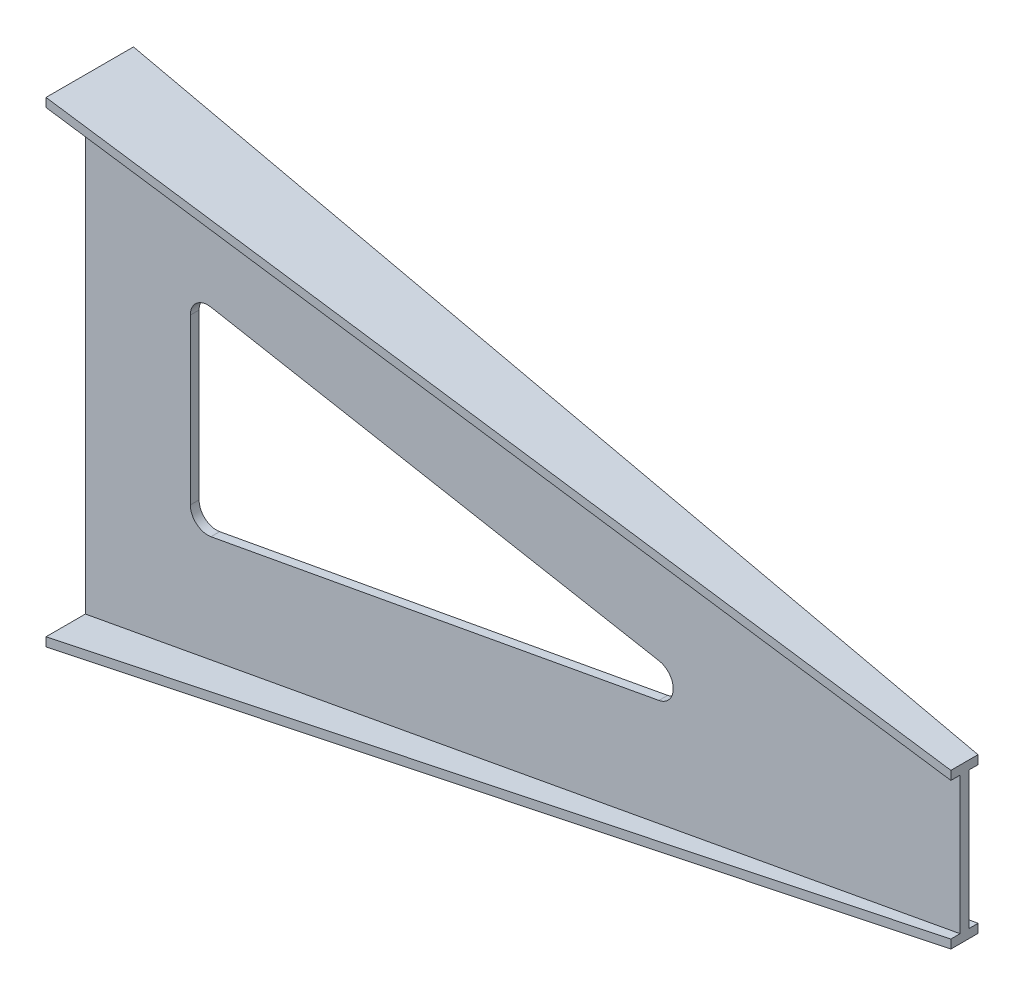
from build123d import *

# Parameters (mm, degrees)
CUT_EXTRUDE1_DEPTH = 1038.790441402


with BuildPart() as part:
    # Sketch1 → Loft l4 section 0
    with BuildSketch(Plane(origin=(0, 0, 0), x_dir=(0, 0, -1), z_dir=(1, 0, 0))):
        with BuildLine():
            Line((-55, 272), (45, 272))
            Line((45, 272), (45, 262))
            Line((45, 262), (0, 262))
            Line((0, 262), (0, -262))
            Line((0, -262), (45, -262))
            Line((45, -262), (45, -272))
            Line((45, -272), (-55, -272))
            Line((-55, -272), (-55, -262))
            Line((-55, -262), (-10, -262))
            Line((-10, -262), (-10, 262))
            Line((-10, 262), (-55, 262))
            Line((-55, 262), (-55, 272))
        make_face()
    # Sketch4 → Loft l4 section 1
    with BuildSketch(Plane(origin=(1000, 0, -1000), x_dir=(0, 0, 1), z_dir=(-1, 0, 0))):
        with BuildLine():
            Line((989.5, 88.5), (1020.5, 88.5))
            Line((1020.5, 88.5), (1020.5, 78.5))
            Line((1020.5, 78.5), (1010, 78.5))
            Line((1010, 78.5), (1010, -78.5))
            Line((1010, -78.5), (1020.5, -78.5))
            Line((1020.5, -78.5), (1020.5, -88.5))
            Line((1020.5, -88.5), (989.5, -88.5))
            Line((989.5, -88.5), (989.5, -78.5))
            Line((989.5, -78.5), (1000, -78.5))
            Line((1000, -78.5), (1000, 78.5))
            Line((1000, 78.5), (989.5, 78.5))
            Line((989.5, 78.5), (989.5, 88.5))
        make_face()
    loft()

    # Sketch5 → Cut-Extrude1 (cut, through all)
    with BuildSketch(Plane.XY.offset(10)):
        with BuildLine():
            Line((143.609729308, -113.644006529), (655.721212502, -19.671549363))
            ThreePointArc((655.721212502, -19.671549363), (672.111483194, 0), (655.721212502, 19.671549363))
            Line((655.721212502, 19.671549363), (143.609729308, 113.644006529))
            ThreePointArc((143.609729308, 113.644006529), (127.197550745, 109.337914956), (120, 93.972457166))
            Line((120, 93.972457166), (120, -93.972457166))
            ThreePointArc((120, -93.972457166), (127.197550745, -109.337914956), (143.609729308, -113.644006529))
        make_face()
    extrude(amount=-CUT_EXTRUDE1_DEPTH, mode=Mode.SUBTRACT)


solid = part.part
